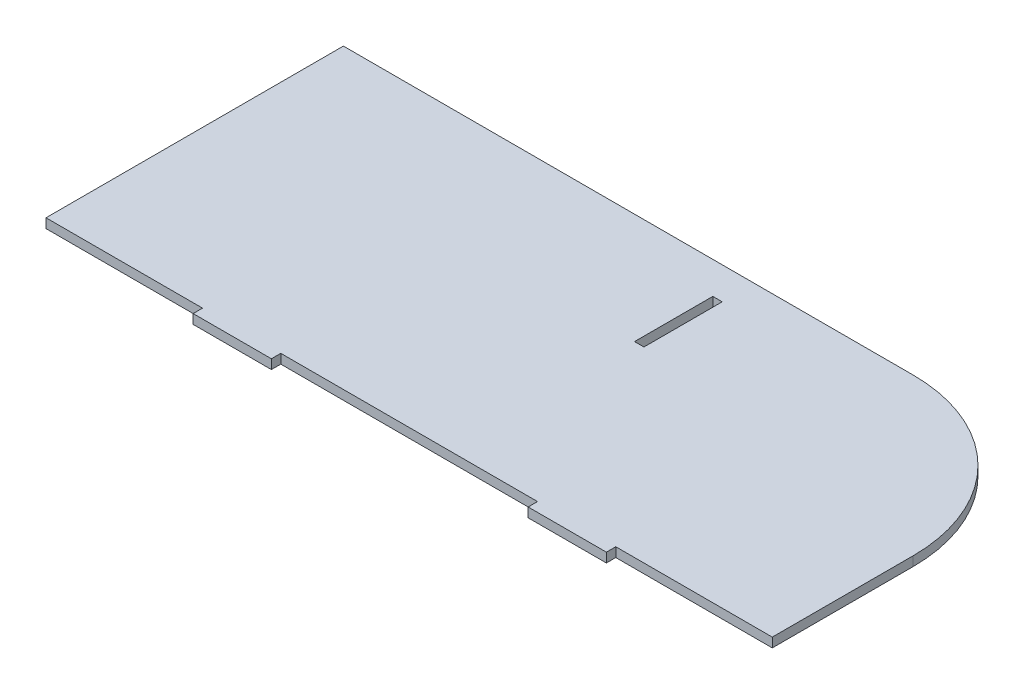
from build123d import *

# Parameters (mm, degrees)
SKETCH1_W           = 6
SKETCH1_H           = 50
BOSS_EXTRUDE1_DEPTH = 6


with BuildPart() as part:
    # Sketch1 → Boss-Extrude1 (new body)
    with BuildSketch(Plane(origin=(0, 0, 0), x_dir=(1, 0, 0), z_dir=(0, 1, 0))):
        with BuildLine():
            Line((-232, -63.959765811), (132, -63.959765811))
            ThreePointArc((132, -63.959765811), (202.710678119, -93.249087693), (232, -163.959765811))
            Line((232, -163.959765811), (232, -253.959765811))
            Line((232, -253.959765811), (132, -253.959765811))
            Line((132, -253.959765811), (132.024572102, -259.959715495))
            Line((132.024572102, -259.959715495), (82.024572102, -259.959765811))
            Line((82.024572102, -259.959765811), (82.024572102, -253.959765811))
            Line((82.024572102, -253.959765811), (-82, -253.959765811))
            Line((-82, -253.959765811), (-82, -259.959765811))
            Line((-82, -259.959765811), (-132, -259.959765811))
            Line((-132, -259.959765811), (-132, -253.959765811))
            Line((-132, -253.959765811), (-232, -253.959765811))
            Line((-232, -253.959765811), (-232, -63.959765811))
        make_face()
        with Locations((27.5, -109.459765811)):
            Rectangle(SKETCH1_W, SKETCH1_H, mode=Mode.SUBTRACT)
    extrude(amount=BOSS_EXTRUDE1_DEPTH)


solid = part.part
